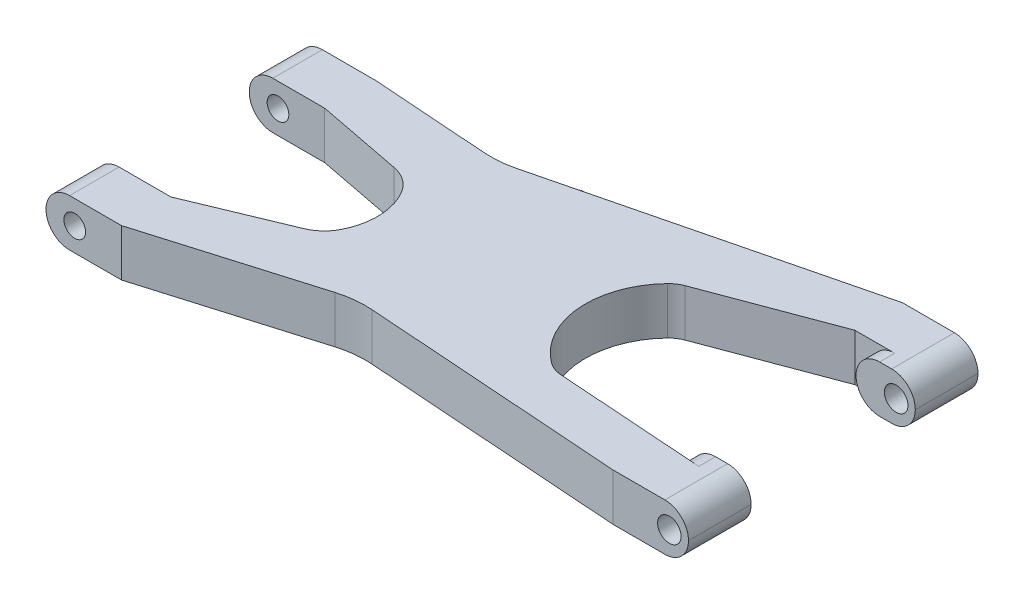
from build123d import *

# Parameters (mm, degrees)
BOSS_EXTRUDE1_DEPTH     = 6.35
FILLET2_R               = 3.175
CUT_EXTRUDE2_DEPTH      = 91.397918676
CUT_EXTRUDE2_DEPTH_BACK = 91.397918676
SKETCH2_R               = 1.5875
SKETCH2_R_2             = 1.4605
CUT_EXTRUDE5_DEPTH      = 91.942464482
CUT_EXTRUDE7_DEPTH      = 25.4
FILLET3_R               = 3.175
SKETCH6_R               = 1.2065
BOSS_EXTRUDE2_DEPTH     = 12.7
SKETCH7_R               = 1.2065
CUT_EXTRUDE8_DEPTH      = 12.7
FILLET5_R               = 12.7
FILLET6_R               = 5.08


with BuildPart() as part:
    # Sketch1 → Boss-Extrude1 (new body)
    with BuildSketch(Plane(origin=(0, 0, 0), x_dir=(1, 0, 0), z_dir=(0, 1, 0))):
        Polygon((0, 0), (0, 38.989), (-10.16, 38.989), (-71.628, 29.4386), (-81.915, 29.4386), (-81.915, -4.5974), (-71.755, -4.5974), (-10.16, 0), align=None)
    extrude(amount=BOSS_EXTRUDE1_DEPTH)

    # Fillet2
    fillet2_edges = [part.edges().sort_by_distance(p)[0] for p in [
        (0, 0, -19.4945),
        (0, 6.35, -19.4945),
        (-81.915, 0, -12.4206),
        (-81.915, 6.35, -12.4206),
    ]]
    fillet(fillet2_edges, radius=FILLET2_R - 0.0001)  # a hair under: the kernel refuses the full size

    # Sketch2 → Cut-Extrude2 (cut, two sides: drawn at the far end of the back side and taken through both)
    with BuildSketch(Plane(origin=(-0.604981675, 0, 0), x_dir=(-1, 0, 0), z_dir=(0, 0, -1)).offset(-CUT_EXTRUDE2_DEPTH_BACK)):
        with Locations((1.966275702, 3.175)):
            Circle(SKETCH2_R)
        with Locations(Location((77.44064574, 3.175, 0), (0, 0, 180))):
            Circle(SKETCH2_R_2)
    extrude(amount=CUT_EXTRUDE2_DEPTH + CUT_EXTRUDE2_DEPTH_BACK, mode=Mode.SUBTRACT)

    # Sketch3 → Cut-Extrude5 (cut, through all)
    with BuildSketch(Plane(origin=(0, 0, 0), x_dir=(1, 0, 0), z_dir=(0, 1, 0))):
        with BuildLine():
            Line((-81.915, 22.7711), (-71.755, 22.7711))
            Line((-71.755, 22.7711), (-58.487579402, 20.207642468))
            ThreePointArc((-58.487579402, 20.207642468), (-55.580114305, 14.192748547), (-57.777398298, 7.883687982))
            Line((-57.777398298, 7.883687982), (-71.755, 2.0701))
            Line((-71.755, 2.0701), (-81.915, 2.0701))
            Line((-81.915, 2.0701), (-81.915, 22.7711))
        make_face()
        with BuildLine():
            Line((0, 30.5435), (0, 8.4455))
            Line((0, 8.4455), (-7.9756, 8.4455))
            Line((-7.9756, 8.4455), (-7.9756, 6.4135))
            Line((-7.9756, 6.4135), (-24.764375431, 7.587485542))
            ThreePointArc((-24.764375431, 7.587485542), (-25.820245836, 7.814780317), (-26.769908004, 8.32923828))
            ThreePointArc((-26.769908004, 8.32923828), (-31.345543526, 16.545378703), (-28.210906636, 25.41191441))
            ThreePointArc((-28.210906636, 25.41191441), (-27.55579932, 25.957953915), (-26.795645997, 26.34459543))
            Line((-26.795645997, 26.34459543), (-10.16, 32.5755))
            Line((-10.16, 32.5755), (-7.9756, 32.5755))
            Line((-7.9756, 32.5755), (-7.9756, 30.5435))
            Line((-7.9756, 30.5435), (0, 30.5435))
        make_face()
    extrude(amount=CUT_EXTRUDE5_DEPTH, mode=Mode.SUBTRACT)

    # Sketch5 → Cut-Extrude7 (cut)
    with BuildSketch(Plane(origin=(0, 6.35, 0), x_dir=(1, 0, 0), z_dir=(0, 1, 0))):
        Polygon((-10.16, 38.989), (-53.78735915, 28.179846815), (-71.628, 29.4386), align=None)
        Polygon((-10.16, 0), (-47.394119509, 2.627067431), (-71.755, -4.5974), align=None)
    extrude(amount=-CUT_EXTRUDE7_DEPTH, mode=Mode.SUBTRACT)

    # Fillet3
    fillet3_edges = [part.edges().sort_by_distance(p)[0] for p in [
        (-7.9756, 0, -7.4295),
        (-7.9756, 6.35, -7.4295),
        (-7.9756, 0, -31.5595),
        (-7.9756, 6.35, -31.5595),
    ]]
    fillet(fillet3_edges, radius=FILLET3_R - 0.0001)  # a hair under: the kernel refuses the full size

    # Sketch7 → Cut-Extrude8 (cut)
    with BuildSketch(Plane(origin=(0, 0, -31.75), x_dir=(-1, 0, 0), z_dir=(0, 0, -1))):
        with Locations(Location((45.72, 3.108706623, 0), (0, 0, 180))):
            Circle(SKETCH7_R)
        with Locations(Location((42.164, 3.108706623, 0), (0, 0, 180))):
            Circle(SKETCH7_R)
    extrude(amount=-CUT_EXTRUDE8_DEPTH, mode=Mode.SUBTRACT)

    # Fillet5
    fillet5_edges = [part.edges().sort_by_distance(p)[0] for p in [
        (-53.78735915, 3.175, -28.179846815),
        (-47.394119509, 3.175, -2.627067431),
    ]]
    fillet(fillet5_edges, radius=FILLET5_R)

    # Fillet6
    fillet6_edges = [part.edges().sort_by_distance(p)[0] for p in [
        (-57.777398298, 3.175, -7.883687982),
        (-58.487579402, 3.175, -20.207642468),
    ]]
    fillet(fillet6_edges, radius=FILLET6_R)


with BuildPart() as body_2:
    # Sketch6 → Boss-Extrude2 (new body)
    with BuildSketch(Plane.XY.offset(-31.75)):
        with BuildLine():
            Line((-45.72, 5.097507922), (-42.164, 5.097507922))
            ThreePointArc((-42.164, 5.097507922), (-40.175198702, 3.108706623), (-42.164, 1.119905325))
            Line((-42.164, 1.119905325), (-45.72, 1.119905325))
            ThreePointArc((-45.72, 1.119905325), (-47.708801298, 3.108706623), (-45.72, 5.097507922))
        make_face()
        with Locations((-45.72, 3.108706623)):
            Circle(SKETCH6_R, mode=Mode.SUBTRACT)
        with Locations((-42.164, 3.108706623)):
            Circle(SKETCH6_R, mode=Mode.SUBTRACT)
    extrude(amount=BOSS_EXTRUDE2_DEPTH)


solid = Compound([part.part, body_2.part])
